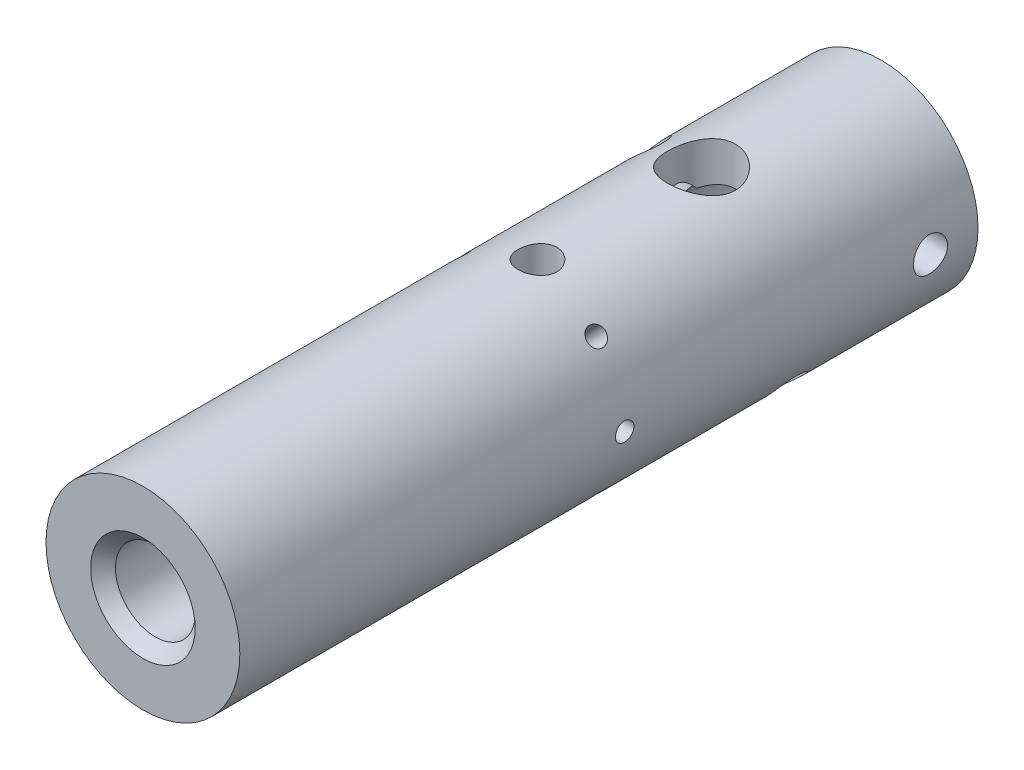
from build123d import *

# Parameters (mm, degrees)
SKETCH1_R                           = 7.9375
EXTRUDE1_DEPTH                      = 30.226
F_5_16_18_TAPPED_HOLE1_D            = 6.5278
F_5_16_18_TAPPED_HOLE1_DEPTH        = 25.4
F_5_16_18_TAPPED_HOLE1_TIP          = 1.961148974
CHAMFER1_SIZE                       = 1.016
F_3_8_0_375_DIAMETER_HOLE1_D        = 9.525
F_3_8_0_375_DIAMETER_HOLE1_DEPTH    = 36.83
F_3_8_0_375_DIAMETER_HOLE1_TIP      = 2.861598698
F_35_0_11_DIAMETER_HOLE4_D          = 2.794
F_53_0_0595_DIAMETER_HOLE1_D        = 1.5113
CIRPATTERN1_COUNT                   = 4
CIRPATTERN1_ANGLE                   = 135
F_7_32_0_21875_DIAMETER_HOLE1_D     = 5.55625
F_7_32_0_21875_DIAMETER_HOLE1_DEPTH = 16.002
F_7_32_0_21875_DIAMETER_HOLE1_TIP   = 1.669265907
F_1_8_0_125_DIAMETER_HOLE8_D        = 3.175
F_1_8_0_125_DIAMETER_HOLE9_D        = 3.175
F_1_8_0_125_DIAMETER_HOLE9_DEPTH    = 16.002
F_1_8_0_125_DIAMETER_HOLE9_TIP      = 0.953866233


with BuildPart() as part:
    # Sketch1 → Extrude1 (new, symmetric)
    with BuildSketch(Plane.XY):
        Circle(SKETCH1_R)
    extrude(amount=EXTRUDE1_DEPTH, both=True)

    # 5/16-18 Tapped Hole1
    with Locations(Plane.XY.offset(30.226)):
        with Locations((0, 0)):
            Hole(F_5_16_18_TAPPED_HOLE1_D / 2, depth=F_5_16_18_TAPPED_HOLE1_DEPTH)
            with Locations((0, 0, -(F_5_16_18_TAPPED_HOLE1_DEPTH + F_5_16_18_TAPPED_HOLE1_TIP / 2))):  # 118° drill point
                Cone(0, F_5_16_18_TAPPED_HOLE1_D / 2, F_5_16_18_TAPPED_HOLE1_TIP, mode=Mode.SUBTRACT)

    # Chamfer1
    chamfer1_edges = [part.edges().sort_by_distance(p)[0] for p in [
        (3.2639, 0, 30.226),
    ]]
    chamfer(chamfer1_edges, length=CHAMFER1_SIZE)

    # 3/8 (0.375) Diameter Hole1
    with Locations(Plane(origin=(0, 0, -30.226), x_dir=(-1, 0, 0), z_dir=(0, 0, -1))):
        with Locations((0, 0)):
            Hole(F_3_8_0_375_DIAMETER_HOLE1_D / 2, depth=F_3_8_0_375_DIAMETER_HOLE1_DEPTH)
            with Locations((0, 0, -(F_3_8_0_375_DIAMETER_HOLE1_DEPTH + F_3_8_0_375_DIAMETER_HOLE1_TIP / 2))):  # 118° drill point
                Cone(0, F_3_8_0_375_DIAMETER_HOLE1_D / 2, F_3_8_0_375_DIAMETER_HOLE1_TIP, mode=Mode.SUBTRACT)

    # #35 (0.11) Diameter Hole4 (through all)
    with Locations(Plane(origin=(7.9375, 0, 0), x_dir=(0, 0, -1), z_dir=(1, 0, 0))):
        with Locations((26.3398, 0)):
            Hole(F_35_0_11_DIAMETER_HOLE4_D / 2)

    # #53 (0.0595) Diameter Hole1 (through all)
    with Locations(Plane(origin=(7.9375, 0, 0), x_dir=(0, 0, -1), z_dir=(1, 0, 0))):
        with Locations((1.2954, 0)):
            f_53_0_0595_diameter_hole1 = Hole(F_53_0_0595_DIAMETER_HOLE1_D / 2)

    # CirPattern1: #53 (0.0595) Diameter Hole1 ×4 about axis
    cirpattern1_axis = Axis((0, 0, 30.226), (0, 0, -1))
    for i in range(1, CIRPATTERN1_COUNT):
        add(f_53_0_0595_diameter_hole1.rotate(cirpattern1_axis, i * CIRPATTERN1_ANGLE / (CIRPATTERN1_COUNT - 1)), mode=Mode.SUBTRACT)

    # 7/32 (0.21875) Diameter Hole1
    with Locations(Plane(origin=(0, 7.9375, -30.226), x_dir=(-1, 0, 0), z_dir=(0, 1, 0))):
        with Locations((0, 14.7066)):
            Hole(F_7_32_0_21875_DIAMETER_HOLE1_D / 2, depth=F_7_32_0_21875_DIAMETER_HOLE1_DEPTH)
            with Locations((0, 0, -(F_7_32_0_21875_DIAMETER_HOLE1_DEPTH + F_7_32_0_21875_DIAMETER_HOLE1_TIP / 2))):  # 118° drill point
                Cone(0, F_7_32_0_21875_DIAMETER_HOLE1_D / 2, F_7_32_0_21875_DIAMETER_HOLE1_TIP, mode=Mode.SUBTRACT)

    # 1/8 (0.125) Diameter Hole8 (through all)
    with Locations(Plane(origin=(-5.612660076, 5.612660076, -30.226), x_dir=(-0.7071067811865489, -0.7071067811865461, 0), z_dir=(-0.7071067811865461, 0.7071067811865489, 0))):
        with Locations((0, 13.5382)):
            Hole(F_1_8_0_125_DIAMETER_HOLE8_D / 2)

    # 1/8 (0.125) Diameter Hole9
    with Locations(Plane(origin=(0, 7.9375, -30.226), x_dir=(-1, 0, 0), z_dir=(0, 1, 0))):
        with Locations((0, 28.1432)):
            Hole(F_1_8_0_125_DIAMETER_HOLE9_D / 2, depth=F_1_8_0_125_DIAMETER_HOLE9_DEPTH)
            with Locations((0, 0, -(F_1_8_0_125_DIAMETER_HOLE9_DEPTH + F_1_8_0_125_DIAMETER_HOLE9_TIP / 2))):  # 118° drill point
                Cone(0, F_1_8_0_125_DIAMETER_HOLE9_D / 2, F_1_8_0_125_DIAMETER_HOLE9_TIP, mode=Mode.SUBTRACT)


solid = part.part
